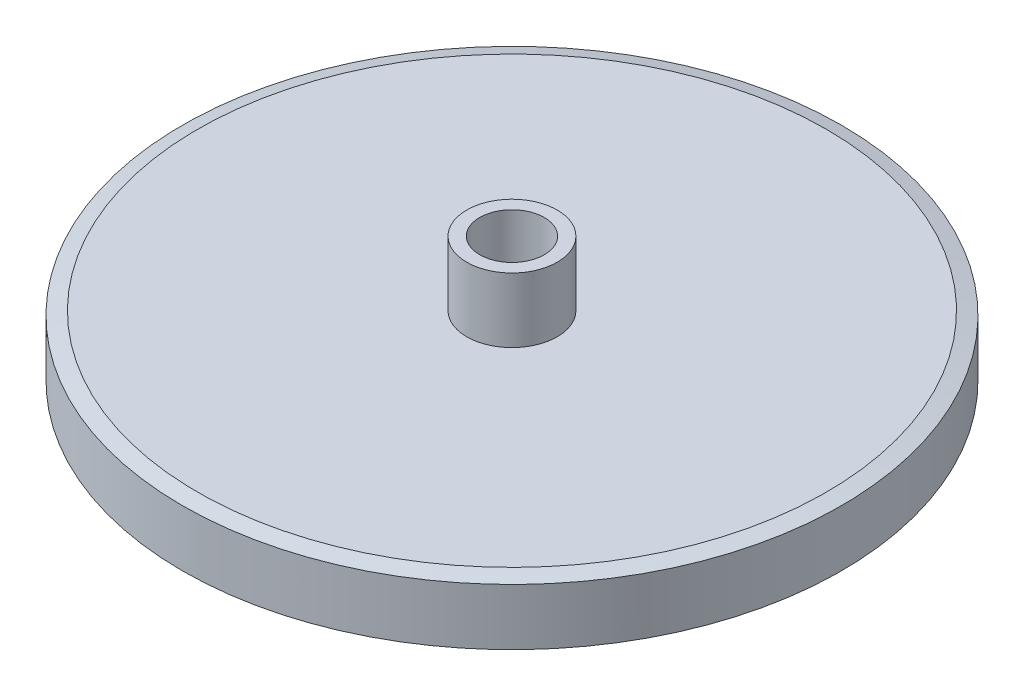
from build123d import *

# Parameters (mm, degrees)
CHAMFER_1_SIZE           = 1.175
CHAMFER_1_SIZE2          = 0.314840301
CUT_EXTRUDE_3_DEPTH      = 38.423254802
CUT_EXTRUDE_3_DEPTH_BACK = 38.423254802
SKETCH_2_R               = 2.5
CHAMFER_2_SIZE           = 1.175
CHAMFER_2_SIZE2          = 0.314840301


with BuildPart() as part:
    # Эскиз1 → Повернуть2 (revolve)
    with BuildSketch(Plane.XY):
        Polygon((0, 0), (25.5, 0), (25.5, 5), (3.5, 5), (3.5, 10), (0, 10), align=None)
    revolve(axis=Axis((0, 10, 0), (0, -1, 0)))

    # Фаска1
    chamfer_1_edges = [part.edges().sort_by_distance(p)[0] for p in [
        (-25.5, 5, 0),
    ]]
    chamfer_1_side = [part.faces().sort_by_distance(p)[0] for p in [
        (-24.778751083, 5, 0),
    ]]
    chamfer(chamfer_1_edges, length=CHAMFER_1_SIZE, length2=CHAMFER_1_SIZE2, reference=chamfer_1_side[0])

    # Эскиз2 → Вырез-Вытянуть3 (cut, two sides: drawn at the far end of the back side and taken through both)
    with BuildSketch(Plane(origin=(0, 0, 0), x_dir=(-1, 0, 0), z_dir=(0, -1, 0)).offset(-CUT_EXTRUDE_3_DEPTH_BACK)):
        Circle(SKETCH_2_R)
    extrude(amount=CUT_EXTRUDE_3_DEPTH + CUT_EXTRUDE_3_DEPTH_BACK, mode=Mode.SUBTRACT)

    # Фаска2
    chamfer_2_edges = [part.edges().sort_by_distance(p)[0] for p in [
        (-25.5, 0, 0),
    ]]
    chamfer_2_side = [part.faces().sort_by_distance(p)[0] for p in [
        (-24.778751083, 0, 0),
    ]]
    chamfer(chamfer_2_edges, length=CHAMFER_2_SIZE, length2=CHAMFER_2_SIZE2, reference=chamfer_2_side[0])


solid = part.part
